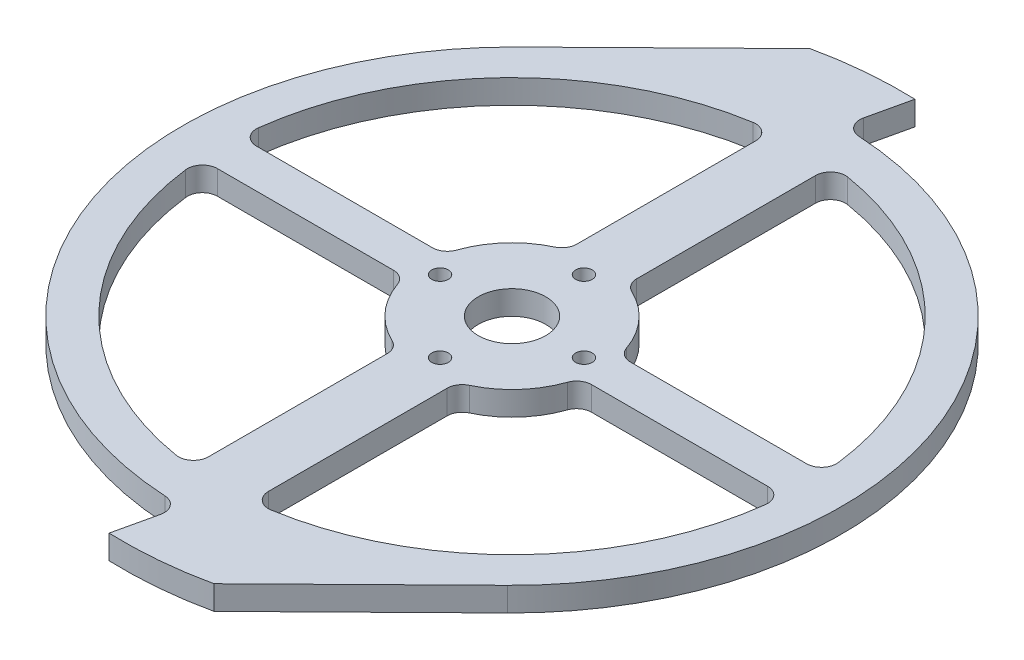
from build123d import *

# Parameters (mm, degrees)
BOSS_EXTRUDE1_DEPTH = 5.08
SKETCH2_R           = 7.14375
SKETCH2_R_2         = 1.7526
CUT_EXTRUDE1_DEPTH  = 6.35
FILLET1_R           = 3.175
FILLET2_R           = 3.175


with BuildPart() as part:
    # Sketch1 → Boss-Extrude1 (new body)
    with BuildSketch(Plane(origin=(0, 0, 0), x_dir=(1, 0, 0), z_dir=(0, 1, 0))):
        with BuildLine():
            Line((0, 69.85), (2.880953453, 82.49971277))
            ThreePointArc((2.880953453, 82.49971277), (-7.374100141, 82.219980218), (-17.515266837, 80.670427838))
            Line((-17.515266837, 80.670427838), (-48.918695819, 49.859639985))
            ThreePointArc((-48.918695819, 49.859639985), (-64.659563689, -26.42278039), (0, -69.85))
            Line((0, -69.85), (-2.880953453, -82.49971277))
            ThreePointArc((-2.880953453, -82.49971277), (7.374100141, -82.219980218), (17.515266837, -80.670427838))
            Line((17.515266837, -80.670427838), (48.918695819, -49.859639985))
            ThreePointArc((48.918695819, -49.859639985), (64.659563689, 26.42278039), (0, 69.85))
        make_face()
        with BuildLine():
            Line((-6.35, 61.585998054), (-6.35, 17.960512242))
            ThreePointArc((-6.35, 17.960512242), (-14.262967443, 12.628153457), (-18.5974795, 4.1275))
            Line((-18.5974795, 4.1275), (-61.774763456, 4.1275))
            ThreePointArc((-61.774763456, 4.1275), (-44.560246842, 42.983043839), (-6.35, 61.585998054))
        make_face(mode=Mode.SUBTRACT)
        with BuildLine():
            Line((6.35, 17.960512242), (6.35, 61.585998054))
            ThreePointArc((6.35, 61.585998054), (44.560246842, 42.983043839), (61.774763456, 4.1275))
            Line((61.774763456, 4.1275), (18.5974795, 4.1275))
            ThreePointArc((18.5974795, 4.1275), (14.262967443, 12.628153457), (6.35, 17.960512242))
        make_face(mode=Mode.SUBTRACT)
        with BuildLine():
            ThreePointArc((-6.35, -61.585998054), (-44.560246842, -42.983043839), (-61.774763456, -4.1275))
            Line((-61.774763456, -4.1275), (-18.5974795, -4.1275))
            ThreePointArc((-18.5974795, -4.1275), (-14.262967443, -12.628153457), (-6.35, -17.960512242))
            Line((-6.35, -17.960512242), (-6.35, -61.585998054))
        make_face(mode=Mode.SUBTRACT)
        with BuildLine():
            ThreePointArc((61.774763456, -4.1275), (44.560246842, -42.983043839), (6.35, -61.585998054))
            Line((6.35, -61.585998054), (6.35, -17.960512242))
            ThreePointArc((6.35, -17.960512242), (14.262967443, -12.628153457), (18.5974795, -4.1275))
            Line((18.5974795, -4.1275), (61.774763456, -4.1275))
        make_face(mode=Mode.SUBTRACT)
    extrude(amount=BOSS_EXTRUDE1_DEPTH)

    # Sketch2 → Cut-Extrude1 (cut)
    with BuildSketch(Plane(origin=(0, 5.08, 0), x_dir=(1, 0, 0), z_dir=(0, 1, 0))):
        Circle(SKETCH2_R)
        with Locations((-15.24, 0)):
            Circle(SKETCH2_R_2)
        with Locations((0, 15.24)):
            Circle(SKETCH2_R_2)
        with Locations((15.24, 0)):
            Circle(SKETCH2_R_2)
        with Locations((0, -15.24)):
            Circle(SKETCH2_R_2)
    extrude(amount=-CUT_EXTRUDE1_DEPTH, mode=Mode.SUBTRACT)

    # Fillet1
    fillet1_edges = [part.edges().sort_by_distance(p)[0] for p in [
        (0, 2.54, 69.85),
        (0, 2.54, -69.85),
    ]]
    fillet(fillet1_edges, radius=FILLET1_R)

    # Fillet2
    fillet2_edges = [part.edges().sort_by_distance(p)[0] for p in [
        (-6.35, 2.54, 61.585998054),
        (18.5974795, 2.54, 4.1275),
        (-61.774763456, 2.54, 4.1275),
        (6.35, 2.54, 17.960512242),
        (-18.5974795, 2.54, 4.1275),
        (-6.35, 2.54, 17.960512242),
        (-6.35, 2.54, -61.585998054),
        (61.774763456, 2.54, 4.1275),
        (6.35, 2.54, 61.585998054),
        (-61.774763456, 2.54, -4.1275),
        (18.5974795, 2.54, -4.1275),
        (6.35, 2.54, -17.960512242),
        (-18.5974795, 2.54, -4.1275),
        (-6.35, 2.54, -17.960512242),
        (61.774763456, 2.54, -4.1275),
        (6.35, 2.54, -61.585998054),
    ]]
    fillet(fillet2_edges, radius=FILLET2_R)


solid = part.part
